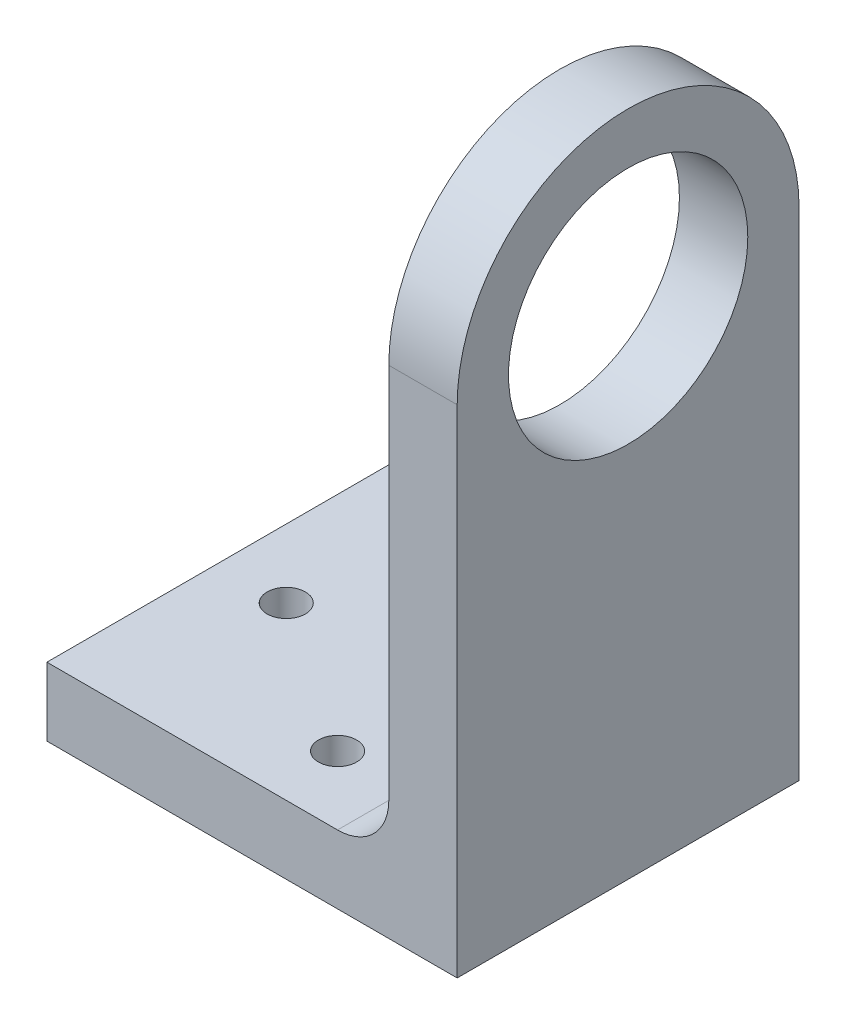
from build123d import *

# Parameters (mm, degrees)
SKETCH3_R           = 11.1125
BOSS_EXTRUDE1_DEPTH = 6.35
SKETCH5_W           = 31.75
SKETCH5_H           = 6.35
BOSS_EXTRUDE2_DEPTH = 38.1
FILLET1_R           = 4.7625
SKETCH6_R           = 1.777000002
CUT_EXTRUDE1_DEPTH  = 72.486121906


with BuildPart() as part:
    # Sketch3 → Boss-Extrude1 (new body)
    with BuildSketch(Plane(origin=(0, 0, 0), x_dir=(0, 0, -1), z_dir=(1, 0, 0))):
        with BuildLine():
            Line((0, 0), (31.75, 0))
            Line((31.75, 0), (31.75, 39.750000002))
            ThreePointArc((31.75, 39.750000002), (15.875, 55.625000002), (0, 39.750000002))
            Line((0, 39.750000002), (0, 0))
        make_face()
        with Locations((15.875, 39.750000002)):
            Circle(SKETCH3_R, mode=Mode.SUBTRACT)
    extrude(amount=BOSS_EXTRUDE1_DEPTH)

    # Sketch5 → Boss-Extrude2 (add)
    with BuildSketch(Plane(origin=(6.35, 0, 0), x_dir=(0, 0, -1), z_dir=(1, 0, 0))):
        with Locations((15.875, -3.175)):
            Rectangle(SKETCH5_W, SKETCH5_H)
    extrude(amount=-BOSS_EXTRUDE2_DEPTH)

    # Fillet1
    fillet1_edges = [part.edges().sort_by_distance(p)[0] for p in [
        (0, 0, -15.875),
    ]]
    fillet(fillet1_edges, radius=FILLET1_R)

    # Sketch6 → Cut-Extrude1 (cut, through all)
    with BuildSketch(Plane(origin=(0, 0, 0), x_dir=(1, 0, 0), z_dir=(0, 1, 0))):
        with Locations((-11.1125, 6.35)):
            Circle(SKETCH6_R)
        with Locations((-25.4, 15.875)):
            Circle(SKETCH6_R)
        with Locations((-11.1125, 25.4)):
            Circle(SKETCH6_R)
    extrude(amount=-CUT_EXTRUDE1_DEPTH, mode=Mode.SUBTRACT)


solid = part.part
